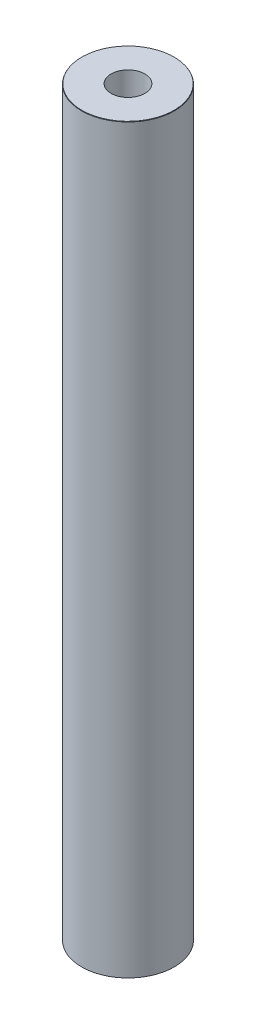
from build123d import *
from OCP.BRepFilletAPI import BRepFilletAPI_MakeChamfer

# Parameters (mm, degrees)
SKETCH1_R           = 37.5
BOSS_EXTRUDE1_DEPTH = 600
SKETCH2_R           = 13.671086063
CUT_EXTRUDE1_DEPTH  = 603.339190158
CHAMFER1_SIZE       = 0.339205045
CHAMFER1_SIZE2      = 0.195840124


with BuildPart() as part:
    # Sketch1 → Boss-Extrude1 (new body)
    with BuildSketch(Plane(origin=(0, 0, 0), x_dir=(1, 0, 0), z_dir=(0, 1, 0))):
        Circle(SKETCH1_R)
    extrude(amount=BOSS_EXTRUDE1_DEPTH)

    # Sketch2 → Cut-Extrude1 (cut, through all)
    with BuildSketch(Plane(origin=(0, 0, 0), x_dir=(1, 0, 0), z_dir=(0, 1, 0))):
        Circle(SKETCH2_R)
    extrude(amount=CUT_EXTRUDE1_DEPTH, mode=Mode.SUBTRACT)

    # Chamfer1: one chamfer whose edges measure the first distance from different faces: ONE call of the kernel's chamfer builder (chamfer() names one face for all edges)
    chamfer1_edges_1 = [part.edges().sort_by_distance(p)[0] for p in [
        (-37.5, 600, 0),
    ]]
    chamfer1_side_1 = [part.faces().sort_by_distance(p)[0] for p in [
        (-37.5, 300, 0),
    ]]
    chamfer1_edges_2 = [part.edges().sort_by_distance(p)[0] for p in [
        (-37.5, 0, 0),
    ]]
    chamfer1_side_2 = [part.faces().sort_by_distance(p)[0] for p in [
        (-36.439339828, 0, 0),
    ]]
    chamfer1 = BRepFilletAPI_MakeChamfer(part.part.solid().wrapped)
    for e in chamfer1_edges_1:
        chamfer1.Add(CHAMFER1_SIZE, CHAMFER1_SIZE2, e.wrapped, chamfer1_side_1[0].wrapped)  # the first distance lies on this face
    for e in chamfer1_edges_2:
        chamfer1.Add(CHAMFER1_SIZE, CHAMFER1_SIZE2, e.wrapped, chamfer1_side_2[0].wrapped)  # the first distance lies on this face
    add(Compound.cast(chamfer1.Shape()), mode=Mode.REPLACE)


solid = part.part
